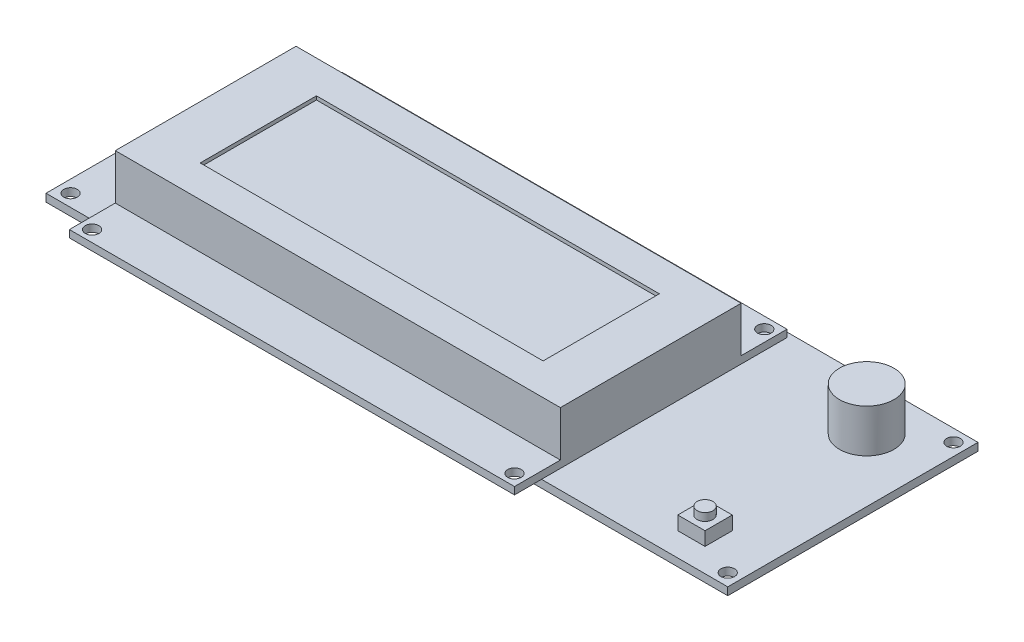
from build123d import *

# Parameters (mm, degrees)
SKETCH1_W           = 150.1
SKETCH1_H           = 55.1
SKETCH1_R           = 1.5
BOSS_EXTRUDE1_DEPTH = 1.7
SKETCH2_W           = 40.8
SKETCH2_H           = 2.5
BOSS_EXTRUDE2_DEPTH = 2.4
SKETCH3_W           = 98
SKETCH3_H           = 60
SKETCH3_R           = 1.5
BOSS_EXTRUDE3_DEPTH = 1.6
SKETCH4_W           = 98
SKETCH4_H           = 39.8
BOSS_EXTRUDE4_DEPTH = 10
SKETCH5_W           = 75.5
SKETCH5_H           = 25.6
CUT_EXTRUDE1_DEPTH  = 0.8
SKETCH6_R           = 6
BOSS_EXTRUDE5_DEPTH = 9.5
SKETCH7_W           = 6
SKETCH7_H           = 6
BOSS_EXTRUDE6_DEPTH = 3
SKETCH8_R           = 1.75
BOSS_EXTRUDE7_DEPTH = 1.7


with BuildPart() as part:
    # Sketch1 → Boss-Extrude1 (new body)
    with BuildSketch(Plane(origin=(0, 0, 0), x_dir=(1, 0, 0), z_dir=(0, 1, 0))):
        Rectangle(SKETCH1_W, SKETCH1_H)
        with Locations((-72.35, 24.85)):
            Circle(SKETCH1_R, mode=Mode.SUBTRACT)
        with Locations((-72.35, -24.85)):
            Circle(SKETCH1_R, mode=Mode.SUBTRACT)
        with Locations((72.35, 24.85)):
            Circle(SKETCH1_R, mode=Mode.SUBTRACT)
        with Locations((72.35, -24.85)):
            Circle(SKETCH1_R, mode=Mode.SUBTRACT)
    extrude(amount=BOSS_EXTRUDE1_DEPTH)

    # Sketch2 → Boss-Extrude2 (add)
    with BuildSketch(Plane(origin=(0, 1.7, 0), x_dir=(1, 0, 0), z_dir=(0, 1, 0))):
        with Locations((-32.85, 21.9)):
            Rectangle(SKETCH2_W, SKETCH2_H)
    extrude(amount=BOSS_EXTRUDE2_DEPTH)

    # Sketch3 → Boss-Extrude3 (add)
    with BuildSketch(Plane(origin=(0, 4.1, 0), x_dir=(1, 0, 0), z_dir=(0, 1, 0))):
        with Locations((-12.55, -5.9)):
            Rectangle(SKETCH3_W, SKETCH3_H)
        with Locations((-59.05, 21.6)):
            Circle(SKETCH3_R, mode=Mode.SUBTRACT)
        with Locations((33.95, 21.6)):
            Circle(SKETCH3_R, mode=Mode.SUBTRACT)
        with Locations((33.95, -33.4)):
            Circle(SKETCH3_R, mode=Mode.SUBTRACT)
        with Locations((-59.05, -33.4)):
            Circle(SKETCH3_R, mode=Mode.SUBTRACT)
    extrude(amount=BOSS_EXTRUDE3_DEPTH)

    # Sketch4 → Boss-Extrude4 (add)
    with BuildSketch(Plane(origin=(0, 5.7, 0), x_dir=(1, 0, 0), z_dir=(0, 1, 0))):
        with Locations((-12.55, -5.9)):
            Rectangle(SKETCH4_W, SKETCH4_H)
    extrude(amount=BOSS_EXTRUDE4_DEPTH)

    # Sketch5 → Cut-Extrude1 (cut)
    with BuildSketch(Plane(origin=(0, 15.7, 0), x_dir=(1, 0, 0), z_dir=(0, 1, 0))):
        with Locations((-12.1, -6)):
            Rectangle(SKETCH5_W, SKETCH5_H)
    extrude(amount=-CUT_EXTRUDE1_DEPTH, mode=Mode.SUBTRACT)

    # Sketch6 → Boss-Extrude5 (add)
    with BuildSketch(Plane(origin=(0, 1.7, 0), x_dir=(1, 0, 0), z_dir=(0, 1, 0))):
        with Locations((61.15, 16.95)):
            Circle(SKETCH6_R)
    extrude(amount=BOSS_EXTRUDE5_DEPTH)

    # Sketch7 → Boss-Extrude6 (add)
    with BuildSketch(Plane(origin=(0, 1.7, 0), x_dir=(1, 0, 0), z_dir=(0, 1, 0))):
        with Locations((61.85, -19.35)):
            Rectangle(SKETCH7_W, SKETCH7_H)
    extrude(amount=BOSS_EXTRUDE6_DEPTH)

    # Sketch8 → Boss-Extrude7 (add)
    with BuildSketch(Plane(origin=(0, 4.7, 0), x_dir=(1, 0, 0), z_dir=(0, 1, 0))):
        with Locations((61.85, -19.35)):
            Circle(SKETCH8_R)
    extrude(amount=BOSS_EXTRUDE7_DEPTH)


solid = part.part
